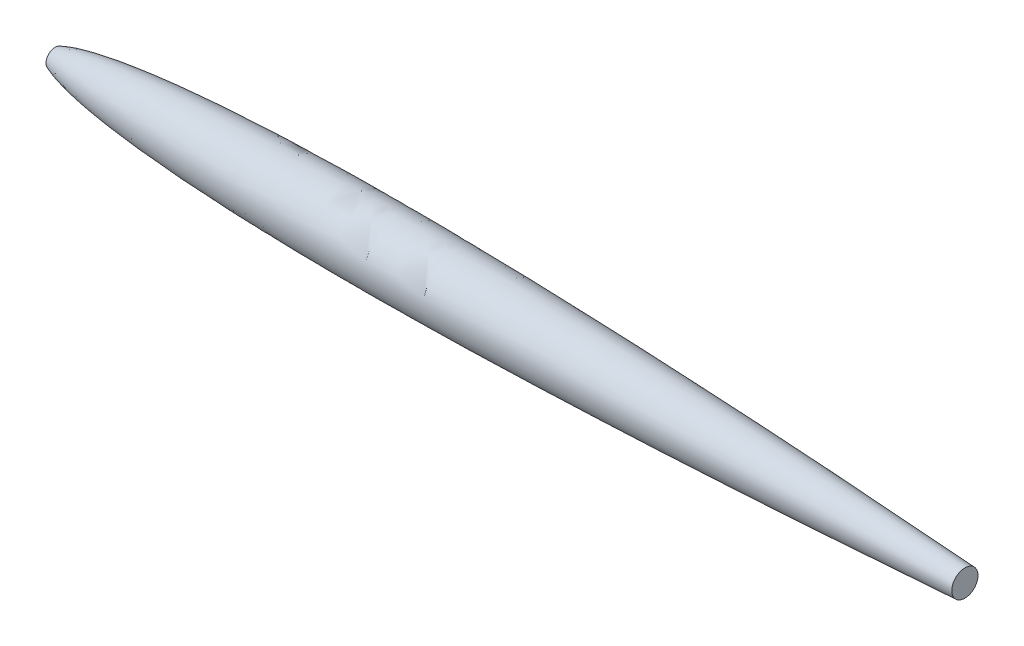
from build123d import *

# Parameters (mm, degrees)
CUTSKETCH_R        = 330
CUT_EXTRUDE1_DEPTH = 9033.067959266
SKETCH1_R          = 330
CUT_EXTRUDE2_DEPTH = 100


with BuildPart() as part:
    # rootSketch → Revolve1 (revolve)
    with BuildSketch(Plane(origin=(0, 0, 0), x_dir=(1, 0, 0), z_dir=(0, 1, 0))):
        with BuildLine():
            Line((0, 0), (10999.999999956, 0))
            add(Edge.make_bspline(
                [(0, 0), (0.000193085, 1.416582005), (0.122535707, 4.240766735), (0.673873379, 8.454686711), (2.109656818, 13.93845879), (4.130019916, 19.114733958), (6.6108994, 23.964322659), (9.99141312, 29.368131534), (13.807367772, 34.371487293), (18.005055091, 39.082436475), (24.006567174, 45.012475537), (32.38394762, 52.235407337), (43.384048479, 60.194382801), (57.076069362, 68.618071155), (73.982979094, 77.724284629), (92.789267205, 86.643497962), (113.957785626, 95.516746756), (137.455558775, 104.311070441), (166.299503437, 114.136034239), (201.291019257, 124.83380424), (243.070199966, 136.204737597), (291.673004407, 147.963968929), (341.243287097, 158.777969553), (390.608018364, 168.603047356), (439.719156269, 177.608967602), (500.651651233, 187.980684512), (573.469223954, 199.282575084), (658.612232457, 211.186619601), (758.084154261, 223.607887379), (859.684753543, 234.995657417), (963.386980877, 245.464526813), (1069.170635517, 255.102838422), (1175.032596375, 263.835414151), (1280.957756037, 271.761542521), (1386.934581972, 278.961621427), (1492.954015963, 285.502236936), (1625.576964573, 292.926255548), (1784.827209806, 300.723903315), (1970.72108882, 308.376208714), (2183.266072594, 315.387382688), (2395.855799019, 320.860371187), (2608.476211675, 324.955727138), (2821.116716449, 327.806853247), (3033.769186051, 329.526860496), (3299.591922937, 330.384071895), (3618.580812409, 329.51376865), (3990.720403141, 326.052290468), (4415.985201528, 319.209100208), (4841.201558049, 309.857365651), (5266.363404579, 298.307410519), (5691.467689334, 284.815055747), (6116.513213618, 269.590680129), (6541.499783516, 252.805736724), (6966.427609798, 234.597307498), (7391.296846876, 215.071528971), (7816.107239786, 194.306117476), (8187.764015612, 175.096544249), (8506.288418891, 157.904884619), (8771.698784382, 143.095088026), (8984.01062255, 130.95609045), (9196.305479291, 118.523403252), (9382.048027901, 107.38440154), (9541.24447253, 97.647382898), (9673.900203702, 89.404934778), (9780.020008578, 82.733097615), (9912.663326878, 74.294734048), (10032.03499694, 66.58027009), (10138.136351112, 59.627723881), (10230.971046534, 53.471278218), (10284.016761583, 49.932402374), (10337.064143493, 46.372127364), (10390.104279802, 42.790919783), (10443.152990441, 39.18744375), (10496.183419271, 35.563459924), (10549.240167305, 31.915530826), (10602.249493916, 28.248814521), (10655.332945198, 24.554271665), (10708.28973189, 20.846283715), (10761.453592237, 17.100380429), (10814.258157127, 13.357501973), (10861.039415372, 10.020132172), (10900.208423325, 7.212345677), (10934.336848159, 4.754530233), (10958.871036751, 2.983522743), (10981.803250473, 1.321442896), (10993.97273069, 0.438031797), (10999.999999956, 0)],
                knots=[0, 0, 0, 0, 0, 0.000464454, 0.000928907, 0.001393361, 0.001857814, 0.002287128, 0.002716441, 0.003486019, 0.003922473, 0.004358926, 0.005488094, 0.007117503, 0.008377929, 0.009638355, 0.011796648, 0.013954941, 0.015918589, 0.017882237, 0.021809533, 0.025977713, 0.030145893, 0.034314073, 0.038482253, 0.042518279, 0.046554305, 0.054626357, 0.062698409, 0.070770462, 0.079497478, 0.088224494, 0.09695151, 0.105678526, 0.114405542, 0.123132558, 0.131859574, 0.14058659, 0.158058513, 0.175530436, 0.193002359, 0.210474282, 0.227946206, 0.24541813, 0.262890054, 0.280361977, 0.315305825, 0.350249672, 0.38519352, 0.420137368, 0.455081215, 0.490025063, 0.524968911, 0.559912758, 0.594856606, 0.629800453, 0.664744301, 0.699688149, 0.717160073, 0.734631996, 0.75210392, 0.769575844, 0.787047768, 0.79578373, 0.804519691, 0.813255653, 0.821991615, 0.839463539, 0.84383152, 0.848199501, 0.852567482, 0.856935463, 0.861303444, 0.865671425, 0.870039406, 0.874407387, 0.878775368, 0.883143349, 0.88751133, 0.891879311, 0.896247292, 0.900615273, 0.902799263, 0.904983254, 0.907167244, 0.909351235, 0.909351235, 0.909351235, 0.909351235, 0.909351235], degree=4))
        make_face()
    revolve(axis=Axis((0, 0, 0), (1, 0, 0)))

    # cutSketch → Cut-Extrude1 (cut, through all)
    with BuildSketch(Plane(origin=(9020, 0, 0), x_dir=(0, 0, -1), z_dir=(1, 0, 0))):
        Circle(CUTSKETCH_R)
    extrude(amount=CUT_EXTRUDE1_DEPTH, mode=Mode.SUBTRACT)

    # Sketch1 → Cut-Extrude2 (cut)
    with BuildSketch(Plane(origin=(0, 0, 0), x_dir=(0, 0, -1), z_dir=(1, 0, 0))):
        Circle(SKETCH1_R)
    extrude(amount=CUT_EXTRUDE2_DEPTH, mode=Mode.SUBTRACT)


solid = part.part
